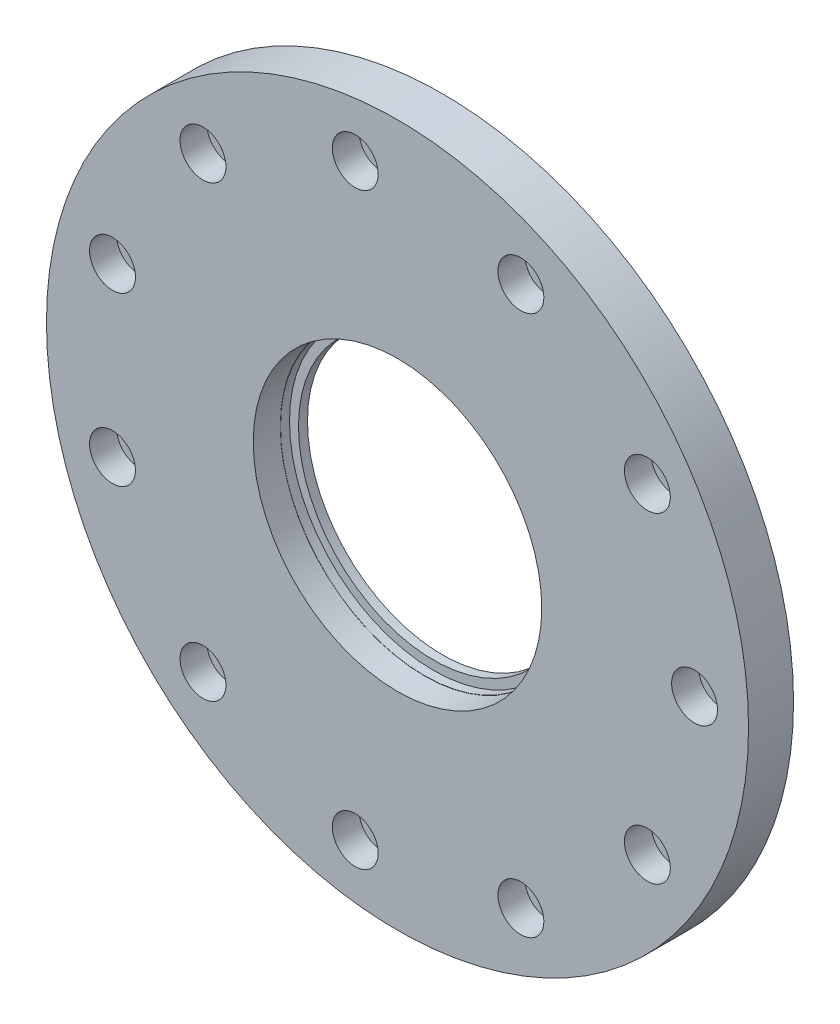
from build123d import *

# Parameters (mm, degrees)
SKETCH1_R           = 39
SKETCH1_R_2         = 2.55
SKETCH1_R_3         = 16.025
BOSS_EXTRUDE1_DEPTH = 3
BOSS_EXTRUDE2_START = 2
SKETCH2_R           = 39
SKETCH2_R_2         = 16
BOSS_EXTRUDE2_DEPTH = 2
SKETCH3_R           = 1.6
CUT_EXTRUDE1_DEPTH  = 56.380501984
SKETCH4_R           = 16
SKETCH4_R_2         = 15
BOSS_EXTRUDE3_DEPTH = 1


with BuildPart() as part:
    # Sketch1 → Boss-Extrude1 (new body)
    with BuildSketch(Plane.XY):
        Circle(SKETCH1_R)
        with Locations((33, 0)):
            Circle(SKETCH1_R_2, mode=Mode.SUBTRACT)
        with Locations((27.761366583, -17.841146976)):
            Circle(SKETCH1_R_2, mode=Mode.SUBTRACT)
        with Locations((13.708695429, -30.017855847)):
            Circle(SKETCH1_R_2, mode=Mode.SUBTRACT)
        with Locations((-4.696389663, -32.664107582)):
            Circle(SKETCH1_R_2, mode=Mode.SUBTRACT)
        with Locations((-21.61040422, -24.939735954)):
            Circle(SKETCH1_R_2, mode=Mode.SUBTRACT)
        with Locations((-31.663268129, -9.297174376)):
            Circle(SKETCH1_R_2, mode=Mode.SUBTRACT)
        with Locations((-31.663268129, 9.297174376)):
            Circle(SKETCH1_R_2, mode=Mode.SUBTRACT)
        with Locations((-21.61040422, 24.939735954)):
            Circle(SKETCH1_R_2, mode=Mode.SUBTRACT)
        with Locations((-4.696389663, 32.664107582)):
            Circle(SKETCH1_R_2, mode=Mode.SUBTRACT)
        with Locations((13.708695429, 30.017855847)):
            Circle(SKETCH1_R_2, mode=Mode.SUBTRACT)
        with Locations((27.761366583, 17.841146976)):
            Circle(SKETCH1_R_2, mode=Mode.SUBTRACT)
        Circle(SKETCH1_R_3, mode=Mode.SUBTRACT)
    extrude(amount=BOSS_EXTRUDE1_DEPTH)

    # Sketch2 → Boss-Extrude2 (add)
    with BuildSketch(Plane(origin=(0, 0, 0), x_dir=(-1, 0, 0), z_dir=(0, 0, -1)).offset(BOSS_EXTRUDE2_START)):
        Circle(SKETCH2_R)
        Circle(SKETCH2_R_2, mode=Mode.SUBTRACT)
    extrude(amount=-BOSS_EXTRUDE2_DEPTH)

    # Sketch3 → Cut-Extrude1 (cut, through all)
    with BuildSketch(Plane.XY.offset(3)):
        with Locations((33, 0)):
            Circle(SKETCH3_R)
        with Locations((27.761366583, -17.841146976)):
            Circle(SKETCH3_R)
        with Locations((13.708695429, -30.017855847)):
            Circle(SKETCH3_R)
        with Locations((-4.696389663, -32.664107582)):
            Circle(SKETCH3_R)
        with Locations((-21.61040422, -24.939735954)):
            Circle(SKETCH3_R)
        with Locations((-31.663268129, -9.297174376)):
            Circle(SKETCH3_R)
        with Locations((-31.663268129, 9.297174376)):
            Circle(SKETCH3_R)
        with Locations((-21.61040422, 24.939735954)):
            Circle(SKETCH3_R)
        with Locations((-4.696389663, 32.664107582)):
            Circle(SKETCH3_R)
        with Locations((13.708695429, 30.017855847)):
            Circle(SKETCH3_R)
        with Locations((27.761366583, 17.841146976)):
            Circle(SKETCH3_R)
    extrude(amount=-CUT_EXTRUDE1_DEPTH, mode=Mode.SUBTRACT)

    # Sketch4 → Boss-Extrude3 (add)
    with BuildSketch(Plane(origin=(0, 0, -2), x_dir=(-1, 0, 0), z_dir=(0, 0, -1))):
        Circle(SKETCH4_R)
        Circle(SKETCH4_R_2, mode=Mode.SUBTRACT)
    extrude(amount=-BOSS_EXTRUDE3_DEPTH)


solid = part.part
